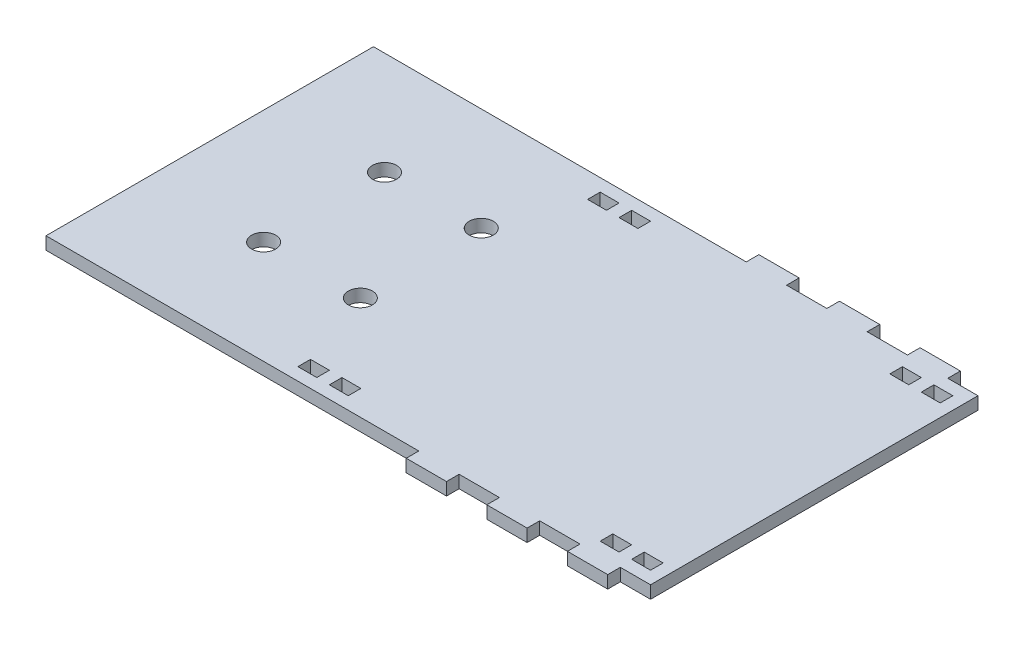
from build123d import *

# Parameters (mm, degrees)
BOSS_EXTRUDE1_DEPTH         = 3.175
SKETCH2_R                   = 3.039013601
CASTER_MOUNTING_HOLES_DEPTH = 89.274136218
SKETCH3_W                   = 4.7625
SKETCH3_H                   = 3.175
CUT_EXTRUDE1_DEPTH          = 89.274136218
LPATTERN1_COUNT             = 2
LPATTERN1_PITCH             = 76.2
LPATTERN1_COUNT_DIR2        = 2
LPATTERN1_PITCH_DIR2        = 73.025


with BuildPart() as part:
    # Sketch1 → Boss-Extrude1 (new body)
    with BuildSketch(Plane(origin=(0, 0, 0), x_dir=(1, 0, 0), z_dir=(0, 1, 0))):
        Polygon((27.94, -41.275), (38.1, -41.275), (38.1, -44.45), (48.26, -44.45), (48.26, -41.275), (58.42, -41.275), (58.42, -44.45), (68.58, -44.45), (68.58, -41.275), (76.2, -41.275), (76.2, 41.275), (68.58, 41.275), (68.58, 44.45), (58.42, 44.45), (58.42, 41.275), (48.26, 41.275), (48.26, 44.45), (38.1, 44.45), (38.1, 41.275), (27.94, 41.275), (27.94, 44.45), (17.78, 44.45), (17.78, 41.275), (-76.2, 41.275), (-76.2, -41.275), (17.78, -41.275), (17.78, -44.45), (27.94, -44.45), align=None)
    extrude(amount=BOSS_EXTRUDE1_DEPTH)

    # Sketch2 → Caster Mounting Holes (cut, through all)
    with BuildSketch(Plane(origin=(0, 3.175, 0), x_dir=(1, 0, 0), z_dir=(0, 1, 0))):
        with Locations((-47.3754273, 15.24)):
            Circle(SKETCH2_R)
        with Locations((-22.9914273, 15.24)):
            Circle(SKETCH2_R)
        with Locations((-22.9914273, -15.24)):
            Circle(SKETCH2_R)
        with Locations((-47.3754273, -15.24)):
            Circle(SKETCH2_R)
    extrude(amount=-CASTER_MOUNTING_HOLES_DEPTH, mode=Mode.SUBTRACT)

    # Sketch3 → Cut-Extrude1 (cut, through all)
    with BuildSketch(Plane(origin=(0, 3.175, 0), x_dir=(1, 0, 0), z_dir=(0, 1, 0))):
        with Locations((62.70625, 36.5125)):
            Rectangle(SKETCH3_W, SKETCH3_H)
        with Locations((70.64375, 36.5125)):
            Rectangle(SKETCH3_W, SKETCH3_H)
    cut_extrude1 = extrude(amount=-CUT_EXTRUDE1_DEPTH, mode=Mode.SUBTRACT)

    # LPattern1: Cut-Extrude1 2 × 2
    with Locations(*[(-i * LPATTERN1_PITCH, 0, j * LPATTERN1_PITCH_DIR2) for i in range(LPATTERN1_COUNT) for j in range(LPATTERN1_COUNT_DIR2) if (i, j) != (0, 0)]):
        add(cut_extrude1, mode=Mode.SUBTRACT)


solid = part.part
